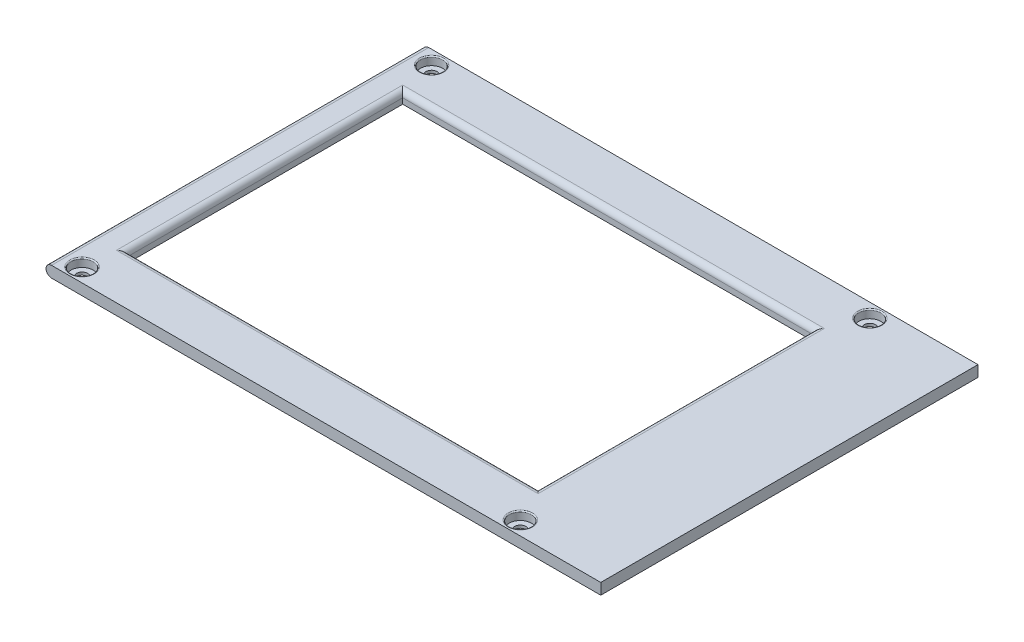
from build123d import *

# Parameters (mm, degrees)
SKETCH_1_W          = 100
SKETCH_1_H          = 68
EXTRUDE_1_DEPTH     = 2
SKETCH_2_R          = 1
CUT_EXTRUDE_1_DEPTH = 2
SKETCH_3_R          = 2
CUT_EXTRUDE_2_DEPTH = 1.5
SKETCH_4_W          = 74
SKETCH_4_H          = 49.6
CUT_EXTRUDE_3_DEPTH = 5
FILLET_1_R          = 1
FILLET_2_R          = 1
FILLET_3_R          = 0.2


with BuildPart() as part:
    # Эскиз1 → Бобышка-Вытянуть1 (new body)
    with BuildSketch(Plane(origin=(0, 0, 0), x_dir=(1, 0, 0), z_dir=(0, 1, 0))):
        Rectangle(SKETCH_1_W, SKETCH_1_H)
    extrude(amount=EXTRUDE_1_DEPTH)

    # Эскиз2 → Вырез-Вытянуть1 (cut)
    with BuildSketch(Plane(origin=(0, 2, 0), x_dir=(1, 0, 0), z_dir=(0, 1, 0))):
        with Locations(Location((-46, 31.5, 0), (0, 0, 270))):
            Circle(SKETCH_2_R)
        with Locations(Location((33, 31.5, 0), (0, 0, 90))):
            Circle(SKETCH_2_R)
        with Locations(Location((33, -31.5, 0), (0, 0, 270))):
            Circle(SKETCH_2_R)
        with Locations(Location((-46, -31.5, 0), (0, 0, 90))):
            Circle(SKETCH_2_R)
    extrude(amount=-CUT_EXTRUDE_1_DEPTH, mode=Mode.SUBTRACT)

    # Эскиз3 → Вырез-Вытянуть2 (cut)
    with BuildSketch(Plane(origin=(0, 2, 0), x_dir=(1, 0, 0), z_dir=(0, 1, 0))):
        with Locations(Location((-46, 31.5, 0), (0, 0, 270))):
            Circle(SKETCH_3_R)
        with Locations(Location((-46, -31.5, 0), (0, 0, 270))):
            Circle(SKETCH_3_R)
        with Locations(Location((33, -31.5, 0), (0, 0, 270))):
            Circle(SKETCH_3_R)
        with Locations(Location((33, 31.5, 0), (0, 0, 270))):
            Circle(SKETCH_3_R)
    extrude(amount=-CUT_EXTRUDE_2_DEPTH, mode=Mode.SUBTRACT)

    # Эскиз4 → Вырез-Вытянуть3 (cut)
    with BuildSketch(Plane(origin=(0, 2, 0), x_dir=(1, 0, 0), z_dir=(0, 1, 0))):
        with Locations((-7.5, 0)):
            Rectangle(SKETCH_4_W, SKETCH_4_H)
    extrude(amount=-CUT_EXTRUDE_3_DEPTH, mode=Mode.SUBTRACT)

    # Скругление1
    fillet_1_edges = [part.edges().sort_by_distance(p)[0] for p in [
        (-7.5, 2, -24.8),
        (-50, 2, 0),
        (-50, 0, 0),
    ]]
    fillet(fillet_1_edges, radius=FILLET_1_R - 0.0001)  # a hair under: the kernel refuses the full size

    # Скругление2
    fillet_2_edges = [part.edges().sort_by_distance(p)[0] for p in [
        (-44.5, 2, -0.49995),
        (-7.5, 2, 24.8),
        (29.5, 2, -0.49995),
    ]]
    fillet(fillet_2_edges, radius=FILLET_2_R - 0.0001)  # a hair under: the kernel refuses the full size

    # Скругление3
    fillet_3_edges = [part.edges().sort_by_distance(p)[0] for p in [
        (-46, 2, -33.5),
        (-46, 2, 29.5),
        (33, 2, 29.5),
        (33, 2, -33.5),
    ]]
    fillet(fillet_3_edges, radius=FILLET_3_R)


solid = part.part
